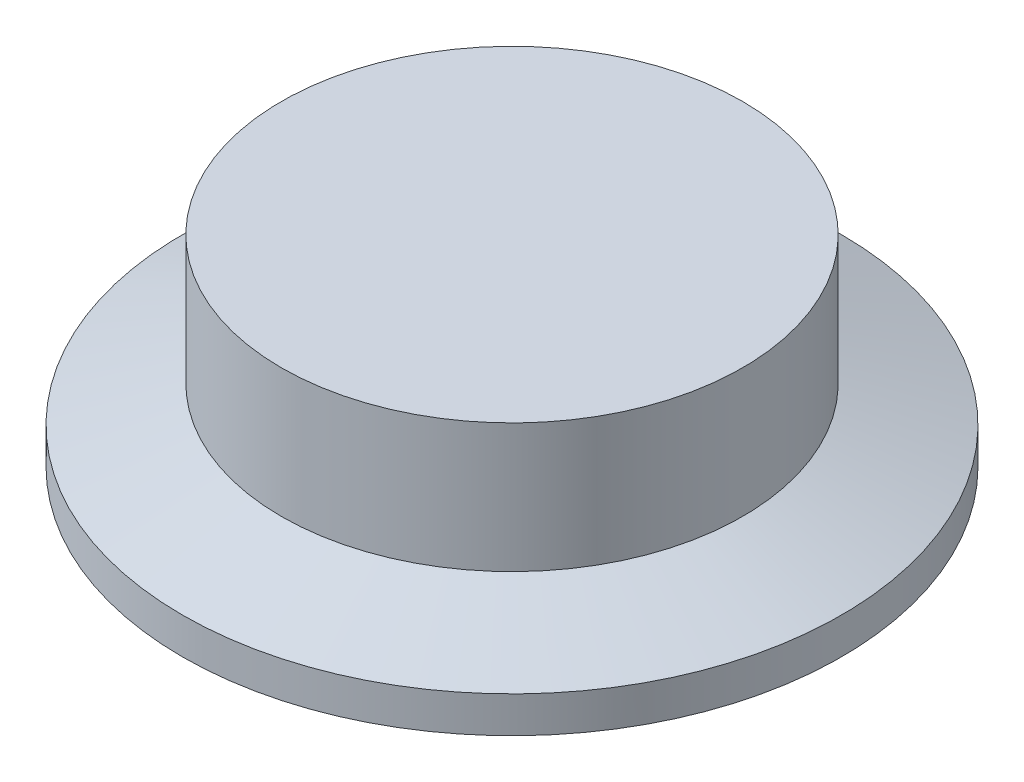
from build123d import *

# Parameters (mm, degrees)
SKETCH1_R                = 93.726
BOSS_EXTRUDE1_DEPTH      = 4.826
SKETCH4_R                = 85.09
SKETCH4_R_2              = 79.375
BOSS_EXTRUDE2_DEPTH      = 12.7
SKETCH5_R                = 1.35255
CUT_EXTRUDE2_DEPTH       = 12.7
CIRPATTERN1_COUNT        = 12
MIRROR2_COPY_1_SKETCH_R  = 1.35255
MIRROR2_COPY_1_DEPTH     = 12.7
MIRROR2_COPY_2_SKETCH_R  = 1.35255
MIRROR2_COPY_2_DEPTH     = 12.7
MIRROR2_COPY_3_SKETCH_R  = 1.35255
MIRROR2_COPY_3_DEPTH     = 12.7
MIRROR2_COPY_4_SKETCH_R  = 1.35255
MIRROR2_COPY_4_DEPTH     = 12.7
MIRROR2_COPY_5_SKETCH_R  = 1.35255
MIRROR2_COPY_5_DEPTH     = 12.7
MIRROR2_COPY_6_SKETCH_R  = 1.35255
MIRROR2_COPY_6_DEPTH     = 12.7
MIRROR2_COPY_7_SKETCH_R  = 1.35255
MIRROR2_COPY_7_DEPTH     = 12.7
MIRROR2_COPY_8_SKETCH_R  = 1.35255
MIRROR2_COPY_8_DEPTH     = 12.7
MIRROR2_COPY_9_SKETCH_R  = 1.35255
MIRROR2_COPY_9_DEPTH     = 12.7
MIRROR2_COPY_10_SKETCH_R = 1.35255
MIRROR2_COPY_10_DEPTH    = 12.7
MIRROR2_COPY_11_SKETCH_R = 1.35255
MIRROR2_COPY_11_DEPTH    = 12.7
CUT_EXTRUDE4_DEPTH       = 135.420006176
CUT_EXTRUDE4_DEPTH_BACK  = 135.420006176
SKETCH7_R                = 127.663800646
SKETCH7_R_2              = 25.4
BOSS_EXTRUDE3_START      = 5.842
SKETCH8_R                = 25.4
BOSS_EXTRUDE3_DEPTH      = 5.842


with BuildPart() as part:
    # Sketch1 → Boss-Extrude1 (new, symmetric)
    with BuildSketch(Plane(origin=(0, 0, 0), x_dir=(1, 0, 0), z_dir=(0, 1, 0))):
        Circle(SKETCH1_R)
    extrude(amount=BOSS_EXTRUDE1_DEPTH, both=True)

    # Sketch2 → Cut-Revolve1 (revolve, cut)
    with BuildSketch(Plane.XY):
        with BuildLine():
            Line((0, -4.826), (-25.4, -4.826))
            add(Edge.make_bspline(
                [(0, 1.27), (-5.119708802, 1.512901127), (-13.685198777, -0.496611023), (-22.158477128, -2.939757283), (-25.4, -4.826)],
                knots=[0, 0, 0, 0, 0.575798634, 1, 1, 1, 1], degree=3))
            Line((0, 1.27), (0, -4.826))
        make_face()
    revolve(axis=Axis((0, -18.327530441, 0), (0, 1, 0)), mode=Mode.SUBTRACT)

    # Sketch4 → Boss-Extrude2 (add)
    with BuildSketch(Plane(origin=(0, 4.826, 0), x_dir=(1, 0, 0), z_dir=(0, 1, 0))):
        Circle(SKETCH4_R)
        Circle(SKETCH4_R_2, mode=Mode.SUBTRACT)
    boss_extrude2 = extrude(amount=BOSS_EXTRUDE2_DEPTH)

    # Sketch5 → Cut-Extrude2 (cut)
    with BuildSketch(Plane(origin=(0, 0, -85.09), x_dir=(-1, 0, 0), z_dir=(0, 0, -1))):
        with Locations((0, 11.176)):
            Circle(SKETCH5_R)
    cut_extrude2 = extrude(amount=-CUT_EXTRUDE2_DEPTH, mode=Mode.SUBTRACT)

    # CirPattern1: Cut-Extrude2 ×12 about axis
    cirpattern1_axis = Axis((0, 17.526, 0), (0, -1, 0))
    for i in range(1, CIRPATTERN1_COUNT):
        add(cut_extrude2.rotate(cirpattern1_axis, i * 360 / CIRPATTERN1_COUNT), mode=Mode.SUBTRACT)

    # Mirror2: Boss-Extrude2, Cut-Extrude2 across plane
    add(boss_extrude2.mirror(Plane.ZX))
    add(cut_extrude2.mirror(Plane.ZX), mode=Mode.SUBTRACT)

    # Mirror2 copy 1 sketch → Mirror2 copy 1 (cut)
    with BuildSketch(Plane(origin=(42.545, 0, -73.690101608), x_dir=(-0.8660254037844387, 0, -0.49999999999999994), z_dir=(0.49999999999999994, 0, -0.8660254037844387))):
        with Locations((0, -11.176)):
            Circle(MIRROR2_COPY_1_SKETCH_R)
    extrude(amount=-MIRROR2_COPY_1_DEPTH, mode=Mode.SUBTRACT)

    # Mirror2 copy 2 sketch → Mirror2 copy 2 (cut)
    with BuildSketch(Plane(origin=(73.690101608, 0, -42.545), x_dir=(-0.5000000000000001, 0, -0.8660254037844386), z_dir=(0.8660254037844386, 0, -0.5000000000000001))):
        with Locations((0, -11.176)):
            Circle(MIRROR2_COPY_2_SKETCH_R)
    extrude(amount=-MIRROR2_COPY_2_DEPTH, mode=Mode.SUBTRACT)

    # Mirror2 copy 3 sketch → Mirror2 copy 3 (cut)
    with BuildSketch(Plane(origin=(85.09, 0, 0), x_dir=(0, 0, -1), z_dir=(1, 0, 0))):
        with Locations((0, -11.176)):
            Circle(MIRROR2_COPY_3_SKETCH_R)
    extrude(amount=-MIRROR2_COPY_3_DEPTH, mode=Mode.SUBTRACT)

    # Mirror2 copy 4 sketch → Mirror2 copy 4 (cut)
    with BuildSketch(Plane(origin=(73.690101608, 0, 42.545), x_dir=(0.4999999999999998, 0, -0.8660254037844387), z_dir=(0.8660254037844387, 0, 0.4999999999999998))):
        with Locations((0, -11.176)):
            Circle(MIRROR2_COPY_4_SKETCH_R)
    extrude(amount=-MIRROR2_COPY_4_DEPTH, mode=Mode.SUBTRACT)

    # Mirror2 copy 5 sketch → Mirror2 copy 5 (cut)
    with BuildSketch(Plane(origin=(42.545, 0, 73.690101608), x_dir=(0.8660254037844387, 0, -0.49999999999999994), z_dir=(0.49999999999999994, 0, 0.8660254037844387))):
        with Locations((0, -11.176)):
            Circle(MIRROR2_COPY_5_SKETCH_R)
    extrude(amount=-MIRROR2_COPY_5_DEPTH, mode=Mode.SUBTRACT)

    # Mirror2 copy 6 sketch → Mirror2 copy 6 (cut)
    with BuildSketch(Plane.XY.offset(85.09)):
        with Locations((0, -11.176)):
            Circle(MIRROR2_COPY_6_SKETCH_R)
    extrude(amount=-MIRROR2_COPY_6_DEPTH, mode=Mode.SUBTRACT)

    # Mirror2 copy 7 sketch → Mirror2 copy 7 (cut)
    with BuildSketch(Plane(origin=(-42.545, 0, 73.690101608), x_dir=(0.8660254037844386, 0, 0.5000000000000001), z_dir=(-0.5000000000000001, 0, 0.8660254037844386))):
        with Locations((0, -11.176)):
            Circle(MIRROR2_COPY_7_SKETCH_R)
    extrude(amount=-MIRROR2_COPY_7_DEPTH, mode=Mode.SUBTRACT)

    # Mirror2 copy 8 sketch → Mirror2 copy 8 (cut)
    with BuildSketch(Plane(origin=(-73.690101608, 0, 42.545), x_dir=(0.5000000000000004, 0, 0.8660254037844384), z_dir=(-0.8660254037844384, 0, 0.5000000000000004))):
        with Locations((0, -11.176)):
            Circle(MIRROR2_COPY_8_SKETCH_R)
    extrude(amount=-MIRROR2_COPY_8_DEPTH, mode=Mode.SUBTRACT)

    # Mirror2 copy 9 sketch → Mirror2 copy 9 (cut)
    with BuildSketch(Plane.ZY.offset(85.09)):
        with Locations((0, -11.176)):
            Circle(MIRROR2_COPY_9_SKETCH_R)
    extrude(amount=-MIRROR2_COPY_9_DEPTH, mode=Mode.SUBTRACT)

    # Mirror2 copy 10 sketch → Mirror2 copy 10 (cut)
    with BuildSketch(Plane(origin=(-73.690101608, 0, -42.545), x_dir=(-0.5000000000000001, 0, 0.8660254037844386), z_dir=(-0.8660254037844386, 0, -0.5000000000000001))):
        with Locations((0, -11.176)):
            Circle(MIRROR2_COPY_10_SKETCH_R)
    extrude(amount=-MIRROR2_COPY_10_DEPTH, mode=Mode.SUBTRACT)

    # Mirror2 copy 11 sketch → Mirror2 copy 11 (cut)
    with BuildSketch(Plane(origin=(-42.545, 0, -73.690101608), x_dir=(-0.8660254037844384, 0, 0.5000000000000004), z_dir=(-0.5000000000000004, 0, -0.8660254037844384))):
        with Locations((0, -11.176)):
            Circle(MIRROR2_COPY_11_SKETCH_R)
    extrude(amount=-MIRROR2_COPY_11_DEPTH, mode=Mode.SUBTRACT)

    # Sketch7 → Cut-Extrude4 (cut, two sides: drawn at the far end of the back side and taken through both)
    with BuildSketch(Plane(origin=(0, 4.826, 0), x_dir=(1, 0, 0), z_dir=(0, 1, 0)).offset(-CUT_EXTRUDE4_DEPTH_BACK)):
        Circle(SKETCH7_R)
        Circle(SKETCH7_R_2, mode=Mode.SUBTRACT)
    extrude(amount=CUT_EXTRUDE4_DEPTH + CUT_EXTRUDE4_DEPTH_BACK, mode=Mode.SUBTRACT)

    # Sketch8 → Boss-Extrude3 (add)
    with BuildSketch(Plane(origin=(0, 4.826, 0), x_dir=(1, 0, 0), z_dir=(0, 1, 0)).offset(BOSS_EXTRUDE3_START)):
        Circle(SKETCH8_R)
    extrude(amount=-BOSS_EXTRUDE3_DEPTH)

    # Sketch9 → Cut-Revolve2 (revolve, cut)
    with BuildSketch(Plane.XY):
        Polygon((25.4, -2.032), (17.78, 0.741453185), (17.78, 10.668), (25.4, 10.668), align=None)
    revolve(axis=Axis((0, 0, 0), (0, 1, 0)), mode=Mode.SUBTRACT)


solid = part.part
